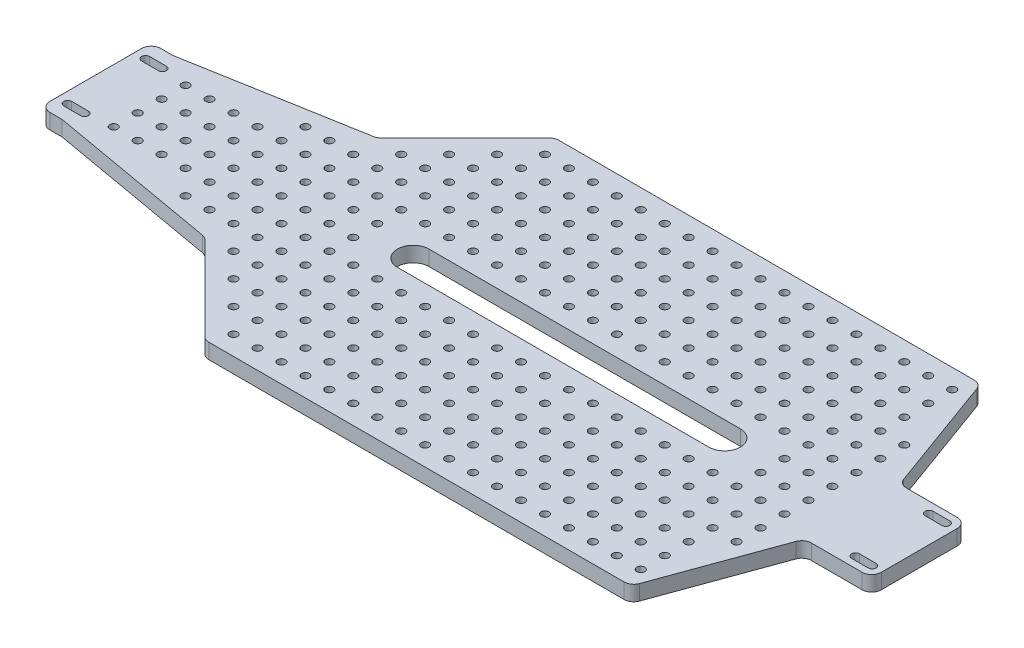
from build123d import *

# Parameters (mm, degrees)
BOSS_EXTRUDE1_DEPTH = 6.35
SKETCH2_R           = 1.65
CUT_EXTRUDE1_DEPTH  = 351.809047952
FILLET1_R           = 4


with BuildPart() as part:
    # Sketch1 → Boss-Extrude1 (new body)
    with BuildSketch(Plane(origin=(0, 0, 0), x_dir=(1, 0, 0), z_dir=(0, 1, 0))):
        Polygon((76.915952747, 52.145069954), (4.55, 39.385), (-4.55, 39.385), (-4.55, -6.885), (4.55, -6.885), (76.915952747, -19.645069954), (114.045882793, -56.775), (291.845882793, -56.775), (311.2, -3.6), (339.2, -3.6), (339.2, 36.1), (311.2, 36.1), (291.845882793, 89.275), (114.045882793, 89.275), align=None)
        with BuildLine():
            Line((7, -1.65), (0, -1.65))
            ThreePointArc((0, -1.65), (-1.65, 0), (0, 1.65))
            Line((0, 1.65), (7, 1.65))
            ThreePointArc((7, 1.65), (8.65, 0), (7, -1.65))
        make_face(mode=Mode.SUBTRACT)
        with BuildLine():
            Line((327.93, 2.525), (334.93, 2.525))
            ThreePointArc((334.93, 2.525), (336.58, 0.875), (334.93, -0.775))
            Line((334.93, -0.775), (327.93, -0.775))
            ThreePointArc((327.93, -0.775), (326.28, 0.875), (327.93, 2.525))
        make_face(mode=Mode.SUBTRACT)
        with BuildLine():
            ThreePointArc((0, 30.85), (-1.65, 32.5), (0, 34.15))
            Line((0, 34.15), (7, 34.15))
            ThreePointArc((7, 34.15), (8.65, 32.5), (7, 30.85))
            Line((7, 30.85), (0, 30.85))
        make_face(mode=Mode.SUBTRACT)
        with BuildLine():
            ThreePointArc((334.93, 33.275), (336.58, 31.625), (334.93, 29.975))
            Line((334.93, 29.975), (327.93, 29.975))
            ThreePointArc((327.93, 29.975), (326.28, 31.625), (327.93, 33.275))
            Line((327.93, 33.275), (334.93, 33.275))
        make_face(mode=Mode.SUBTRACT)
    extrude(amount=BOSS_EXTRUDE1_DEPTH)

    # Sketch2 → Cut-Extrude1 (cut, through all)
    with BuildSketch(Plane(origin=(0, 6.35, 0), x_dir=(1, 0, 0), z_dir=(0, 1, 0))):
        with Locations((117.945882793, 81.245)):
            Circle(SKETCH2_R)
        with Locations((127.945882793, 81.245)):
            Circle(SKETCH2_R)
        with Locations((137.945882793, 81.245)):
            Circle(SKETCH2_R)
        with Locations((147.945882793, 81.245)):
            Circle(SKETCH2_R)
        with Locations((157.945882793, 81.245)):
            Circle(SKETCH2_R)
        with Locations((167.945882793, 81.245)):
            Circle(SKETCH2_R)
        with Locations((177.945882793, 81.245)):
            Circle(SKETCH2_R)
        with Locations((187.945882793, 81.245)):
            Circle(SKETCH2_R)
        with Locations((197.945882793, 81.245)):
            Circle(SKETCH2_R)
        with Locations((207.945882793, 81.245)):
            Circle(SKETCH2_R)
        with Locations((217.945882793, 81.245)):
            Circle(SKETCH2_R)
        with Locations((227.945882793, 81.245)):
            Circle(SKETCH2_R)
        with Locations((237.945882793, 81.245)):
            Circle(SKETCH2_R)
        with Locations((247.945882793, 81.245)):
            Circle(SKETCH2_R)
        with Locations((257.945882793, 81.245)):
            Circle(SKETCH2_R)
        with Locations((267.945882793, 81.245)):
            Circle(SKETCH2_R)
        with Locations((277.945882793, 81.245)):
            Circle(SKETCH2_R)
        with Locations((287.945882793, 81.245)):
            Circle(SKETCH2_R)
        with Locations((127.945882793, 71.245)):
            Circle(SKETCH2_R)
        with Locations((137.945882793, 71.245)):
            Circle(SKETCH2_R)
        with Locations((147.945882793, 71.245)):
            Circle(SKETCH2_R)
        with Locations((157.945882793, 71.245)):
            Circle(SKETCH2_R)
        with Locations((167.945882793, 71.245)):
            Circle(SKETCH2_R)
        with Locations((177.945882793, 71.245)):
            Circle(SKETCH2_R)
        with Locations((187.945882793, 71.245)):
            Circle(SKETCH2_R)
        with Locations((197.945882793, 71.245)):
            Circle(SKETCH2_R)
        with Locations((207.945882793, 71.245)):
            Circle(SKETCH2_R)
        with Locations((217.945882793, 71.245)):
            Circle(SKETCH2_R)
        with Locations((227.945882793, 71.245)):
            Circle(SKETCH2_R)
        with Locations((237.945882793, 71.245)):
            Circle(SKETCH2_R)
        with Locations((247.945882793, 71.245)):
            Circle(SKETCH2_R)
        with Locations((257.945882793, 71.245)):
            Circle(SKETCH2_R)
        with Locations((267.945882793, 71.245)):
            Circle(SKETCH2_R)
        with Locations((277.945882793, 71.245)):
            Circle(SKETCH2_R)
        with Locations((287.945882793, 71.245)):
            Circle(SKETCH2_R)
        with Locations((127.945882793, 61.245)):
            Circle(SKETCH2_R)
        with Locations((137.945882793, 61.245)):
            Circle(SKETCH2_R)
        with Locations((147.945882793, 61.245)):
            Circle(SKETCH2_R)
        with Locations((157.945882793, 61.245)):
            Circle(SKETCH2_R)
        with Locations((167.945882793, 61.245)):
            Circle(SKETCH2_R)
        with Locations((177.945882793, 61.245)):
            Circle(SKETCH2_R)
        with Locations((187.945882793, 61.245)):
            Circle(SKETCH2_R)
        with Locations((197.945882793, 61.245)):
            Circle(SKETCH2_R)
        with Locations((207.945882793, 61.245)):
            Circle(SKETCH2_R)
        with Locations((217.945882793, 61.245)):
            Circle(SKETCH2_R)
        with Locations((227.945882793, 61.245)):
            Circle(SKETCH2_R)
        with Locations((237.945882793, 61.245)):
            Circle(SKETCH2_R)
        with Locations((247.945882793, 61.245)):
            Circle(SKETCH2_R)
        with Locations((257.945882793, 61.245)):
            Circle(SKETCH2_R)
        with Locations((267.945882793, 61.245)):
            Circle(SKETCH2_R)
        with Locations((277.945882793, 61.245)):
            Circle(SKETCH2_R)
        with Locations((287.945882793, 61.245)):
            Circle(SKETCH2_R)
        with Locations((127.945882793, 51.245)):
            Circle(SKETCH2_R)
        with Locations((137.945882793, 51.245)):
            Circle(SKETCH2_R)
        with Locations((147.945882793, 51.245)):
            Circle(SKETCH2_R)
        with Locations((157.945882793, 51.245)):
            Circle(SKETCH2_R)
        with Locations((167.945882793, 51.245)):
            Circle(SKETCH2_R)
        with Locations((177.945882793, 51.245)):
            Circle(SKETCH2_R)
        with Locations((187.945882793, 51.245)):
            Circle(SKETCH2_R)
        with Locations((197.945882793, 51.245)):
            Circle(SKETCH2_R)
        with Locations((207.945882793, 51.245)):
            Circle(SKETCH2_R)
        with Locations((217.945882793, 51.245)):
            Circle(SKETCH2_R)
        with Locations((227.945882793, 51.245)):
            Circle(SKETCH2_R)
        with Locations((237.945882793, 51.245)):
            Circle(SKETCH2_R)
        with Locations((247.945882793, 51.245)):
            Circle(SKETCH2_R)
        with Locations((257.945882793, 51.245)):
            Circle(SKETCH2_R)
        with Locations((267.945882793, 51.245)):
            Circle(SKETCH2_R)
        with Locations((277.945882793, 51.245)):
            Circle(SKETCH2_R)
        with Locations((287.945882793, 51.245)):
            Circle(SKETCH2_R)
        with Locations((127.945882793, 41.245)):
            Circle(SKETCH2_R)
        with Locations((137.945882793, 41.245)):
            Circle(SKETCH2_R)
        with Locations((147.945882793, 41.245)):
            Circle(SKETCH2_R)
        with Locations((157.945882793, 41.245)):
            Circle(SKETCH2_R)
        with Locations((167.945882793, 41.245)):
            Circle(SKETCH2_R)
        with Locations((177.945882793, 41.245)):
            Circle(SKETCH2_R)
        with Locations((187.945882793, 41.245)):
            Circle(SKETCH2_R)
        with Locations((197.945882793, 41.245)):
            Circle(SKETCH2_R)
        with Locations((207.945882793, 41.245)):
            Circle(SKETCH2_R)
        with Locations((217.945882793, 41.245)):
            Circle(SKETCH2_R)
        with Locations((227.945882793, 41.245)):
            Circle(SKETCH2_R)
        with Locations((237.945882793, 41.245)):
            Circle(SKETCH2_R)
        with Locations((247.945882793, 41.245)):
            Circle(SKETCH2_R)
        with Locations((257.945882793, 41.245)):
            Circle(SKETCH2_R)
        with Locations((267.945882793, 41.245)):
            Circle(SKETCH2_R)
        with Locations((277.945882793, 41.245)):
            Circle(SKETCH2_R)
        with Locations((287.945882793, 41.245)):
            Circle(SKETCH2_R)
        with Locations((127.945882793, 31.245)):
            Circle(SKETCH2_R)
        with Locations((137.945882793, 31.245)):
            Circle(SKETCH2_R)
        with Locations((147.945882793, 31.245)):
            Circle(SKETCH2_R)
        with Locations((157.945882793, 31.245)):
            Circle(SKETCH2_R)
        with Locations((167.945882793, 31.245)):
            Circle(SKETCH2_R)
        with Locations((177.945882793, 31.245)):
            Circle(SKETCH2_R)
        with Locations((187.945882793, 31.245)):
            Circle(SKETCH2_R)
        with Locations((197.945882793, 31.245)):
            Circle(SKETCH2_R)
        with Locations((207.945882793, 31.245)):
            Circle(SKETCH2_R)
        with Locations((217.945882793, 31.245)):
            Circle(SKETCH2_R)
        with Locations((227.945882793, 31.245)):
            Circle(SKETCH2_R)
        with Locations((237.945882793, 31.245)):
            Circle(SKETCH2_R)
        with Locations((247.945882793, 31.245)):
            Circle(SKETCH2_R)
        with Locations((257.945882793, 31.245)):
            Circle(SKETCH2_R)
        with Locations((267.945882793, 31.245)):
            Circle(SKETCH2_R)
        with Locations((277.945882793, 31.245)):
            Circle(SKETCH2_R)
        with Locations((287.945882793, 31.245)):
            Circle(SKETCH2_R)
        with Locations((277.945882793, 21.245)):
            Circle(SKETCH2_R)
        with Locations((287.945882793, 21.245)):
            Circle(SKETCH2_R)
        with Locations((277.945882793, 11.245)):
            Circle(SKETCH2_R)
        with Locations((287.945882793, 11.245)):
            Circle(SKETCH2_R)
        with Locations((127.945882793, 1.245)):
            Circle(SKETCH2_R)
        with Locations((137.945882793, 1.245)):
            Circle(SKETCH2_R)
        with Locations((147.945882793, 1.245)):
            Circle(SKETCH2_R)
        with Locations((157.945882793, 1.245)):
            Circle(SKETCH2_R)
        with Locations((167.945882793, 1.245)):
            Circle(SKETCH2_R)
        with Locations((177.945882793, 1.245)):
            Circle(SKETCH2_R)
        with Locations((187.945882793, 1.245)):
            Circle(SKETCH2_R)
        with Locations((197.945882793, 1.245)):
            Circle(SKETCH2_R)
        with Locations((207.945882793, 1.245)):
            Circle(SKETCH2_R)
        with Locations((217.945882793, 1.245)):
            Circle(SKETCH2_R)
        with Locations((227.945882793, 1.245)):
            Circle(SKETCH2_R)
        with Locations((237.945882793, 1.245)):
            Circle(SKETCH2_R)
        with Locations((247.945882793, 1.245)):
            Circle(SKETCH2_R)
        with Locations((257.945882793, 1.245)):
            Circle(SKETCH2_R)
        with Locations((267.945882793, 1.245)):
            Circle(SKETCH2_R)
        with Locations((277.945882793, 1.245)):
            Circle(SKETCH2_R)
        with Locations((287.945882793, 1.245)):
            Circle(SKETCH2_R)
        with Locations((127.945882793, -8.755)):
            Circle(SKETCH2_R)
        with Locations((137.945882793, -8.755)):
            Circle(SKETCH2_R)
        with Locations((147.945882793, -8.755)):
            Circle(SKETCH2_R)
        with Locations((157.945882793, -8.755)):
            Circle(SKETCH2_R)
        with Locations((167.945882793, -8.755)):
            Circle(SKETCH2_R)
        with Locations((177.945882793, -8.755)):
            Circle(SKETCH2_R)
        with Locations((187.945882793, -8.755)):
            Circle(SKETCH2_R)
        with Locations((197.945882793, -8.755)):
            Circle(SKETCH2_R)
        with Locations((207.945882793, -8.755)):
            Circle(SKETCH2_R)
        with Locations((217.945882793, -8.755)):
            Circle(SKETCH2_R)
        with Locations((227.945882793, -8.755)):
            Circle(SKETCH2_R)
        with Locations((237.945882793, -8.755)):
            Circle(SKETCH2_R)
        with Locations((247.945882793, -8.755)):
            Circle(SKETCH2_R)
        with Locations((257.945882793, -8.755)):
            Circle(SKETCH2_R)
        with Locations((267.945882793, -8.755)):
            Circle(SKETCH2_R)
        with Locations((277.945882793, -8.755)):
            Circle(SKETCH2_R)
        with Locations((287.945882793, -8.755)):
            Circle(SKETCH2_R)
        with Locations((127.945882793, -18.755)):
            Circle(SKETCH2_R)
        with Locations((137.945882793, -18.755)):
            Circle(SKETCH2_R)
        with Locations((147.945882793, -18.755)):
            Circle(SKETCH2_R)
        with Locations((157.945882793, -18.755)):
            Circle(SKETCH2_R)
        with Locations((167.945882793, -18.755)):
            Circle(SKETCH2_R)
        with Locations((177.945882793, -18.755)):
            Circle(SKETCH2_R)
        with Locations((187.945882793, -18.755)):
            Circle(SKETCH2_R)
        with Locations((197.945882793, -18.755)):
            Circle(SKETCH2_R)
        with Locations((207.945882793, -18.755)):
            Circle(SKETCH2_R)
        with Locations((217.945882793, -18.755)):
            Circle(SKETCH2_R)
        with Locations((227.945882793, -18.755)):
            Circle(SKETCH2_R)
        with Locations((237.945882793, -18.755)):
            Circle(SKETCH2_R)
        with Locations((247.945882793, -18.755)):
            Circle(SKETCH2_R)
        with Locations((257.945882793, -18.755)):
            Circle(SKETCH2_R)
        with Locations((267.945882793, -18.755)):
            Circle(SKETCH2_R)
        with Locations((277.945882793, -18.755)):
            Circle(SKETCH2_R)
        with Locations((287.945882793, -18.755)):
            Circle(SKETCH2_R)
        with Locations((127.945882793, -28.755)):
            Circle(SKETCH2_R)
        with Locations((137.945882793, -28.755)):
            Circle(SKETCH2_R)
        with Locations((147.945882793, -28.755)):
            Circle(SKETCH2_R)
        with Locations((157.945882793, -28.755)):
            Circle(SKETCH2_R)
        with Locations((167.945882793, -28.755)):
            Circle(SKETCH2_R)
        with Locations((177.945882793, -28.755)):
            Circle(SKETCH2_R)
        with Locations((187.945882793, -28.755)):
            Circle(SKETCH2_R)
        with Locations((197.945882793, -28.755)):
            Circle(SKETCH2_R)
        with Locations((207.945882793, -28.755)):
            Circle(SKETCH2_R)
        with Locations((217.945882793, -28.755)):
            Circle(SKETCH2_R)
        with Locations((227.945882793, -28.755)):
            Circle(SKETCH2_R)
        with Locations((237.945882793, -28.755)):
            Circle(SKETCH2_R)
        with Locations((247.945882793, -28.755)):
            Circle(SKETCH2_R)
        with Locations((257.945882793, -28.755)):
            Circle(SKETCH2_R)
        with Locations((267.945882793, -28.755)):
            Circle(SKETCH2_R)
        with Locations((277.945882793, -28.755)):
            Circle(SKETCH2_R)
        with Locations((287.945882793, -28.755)):
            Circle(SKETCH2_R)
        with Locations((127.945882793, -38.755)):
            Circle(SKETCH2_R)
        with Locations((137.945882793, -38.755)):
            Circle(SKETCH2_R)
        with Locations((147.945882793, -38.755)):
            Circle(SKETCH2_R)
        with Locations((157.945882793, -38.755)):
            Circle(SKETCH2_R)
        with Locations((167.945882793, -38.755)):
            Circle(SKETCH2_R)
        with Locations((177.945882793, -38.755)):
            Circle(SKETCH2_R)
        with Locations((187.945882793, -38.755)):
            Circle(SKETCH2_R)
        with Locations((197.945882793, -38.755)):
            Circle(SKETCH2_R)
        with Locations((207.945882793, -38.755)):
            Circle(SKETCH2_R)
        with Locations((217.945882793, -38.755)):
            Circle(SKETCH2_R)
        with Locations((227.945882793, -38.755)):
            Circle(SKETCH2_R)
        with Locations((237.945882793, -38.755)):
            Circle(SKETCH2_R)
        with Locations((247.945882793, -38.755)):
            Circle(SKETCH2_R)
        with Locations((257.945882793, -38.755)):
            Circle(SKETCH2_R)
        with Locations((267.945882793, -38.755)):
            Circle(SKETCH2_R)
        with Locations((277.945882793, -38.755)):
            Circle(SKETCH2_R)
        with Locations((287.945882793, -38.755)):
            Circle(SKETCH2_R)
        with Locations((127.945882793, -48.755)):
            Circle(SKETCH2_R)
        with Locations((137.945882793, -48.755)):
            Circle(SKETCH2_R)
        with Locations((147.945882793, -48.755)):
            Circle(SKETCH2_R)
        with Locations((157.945882793, -48.755)):
            Circle(SKETCH2_R)
        with Locations((167.945882793, -48.755)):
            Circle(SKETCH2_R)
        with Locations((177.945882793, -48.755)):
            Circle(SKETCH2_R)
        with Locations((187.945882793, -48.755)):
            Circle(SKETCH2_R)
        with Locations((197.945882793, -48.755)):
            Circle(SKETCH2_R)
        with Locations((207.945882793, -48.755)):
            Circle(SKETCH2_R)
        with Locations((217.945882793, -48.755)):
            Circle(SKETCH2_R)
        with Locations((227.945882793, -48.755)):
            Circle(SKETCH2_R)
        with Locations((237.945882793, -48.755)):
            Circle(SKETCH2_R)
        with Locations((247.945882793, -48.755)):
            Circle(SKETCH2_R)
        with Locations((257.945882793, -48.755)):
            Circle(SKETCH2_R)
        with Locations((267.945882793, -48.755)):
            Circle(SKETCH2_R)
        with Locations((277.945882793, -48.755)):
            Circle(SKETCH2_R)
        with Locations((287.945882793, -48.755)):
            Circle(SKETCH2_R)
        with Locations((117.945882793, 71.245)):
            Circle(SKETCH2_R)
        with Locations((117.945882793, 61.245)):
            Circle(SKETCH2_R)
        with Locations((117.945882793, 51.245)):
            Circle(SKETCH2_R)
        with Locations((117.945882793, 41.245)):
            Circle(SKETCH2_R)
        with Locations((117.945882793, 31.245)):
            Circle(SKETCH2_R)
        with Locations((117.945882793, 1.245)):
            Circle(SKETCH2_R)
        with Locations((117.945882793, -8.755)):
            Circle(SKETCH2_R)
        with Locations((117.945882793, -18.755)):
            Circle(SKETCH2_R)
        with Locations((117.945882793, -28.755)):
            Circle(SKETCH2_R)
        with Locations((117.945882793, -38.755)):
            Circle(SKETCH2_R)
        with Locations((117.945882793, -48.755)):
            Circle(SKETCH2_R)
        with Locations((297.945882793, 51.245)):
            Circle(SKETCH2_R)
        with Locations((297.945882793, 41.245)):
            Circle(SKETCH2_R)
        with Locations((297.945882793, 31.245)):
            Circle(SKETCH2_R)
        with Locations((297.945882793, 21.245)):
            Circle(SKETCH2_R)
        with Locations((297.945882793, 11.245)):
            Circle(SKETCH2_R)
        with Locations((297.945882793, 1.245)):
            Circle(SKETCH2_R)
        with Locations((297.945882793, -8.755)):
            Circle(SKETCH2_R)
        with Locations((297.945882793, -18.755)):
            Circle(SKETCH2_R)
        with Locations((107.945882793, 71.245)):
            Circle(SKETCH2_R)
        with Locations((97.945882793, 61.245)):
            Circle(SKETCH2_R)
        with Locations((97.945882793, 51.245)):
            Circle(SKETCH2_R)
        with Locations((87.945882793, 51.245)):
            Circle(SKETCH2_R)
        with Locations((97.945882793, 41.245)):
            Circle(SKETCH2_R)
        with Locations((87.945882793, 41.245)):
            Circle(SKETCH2_R)
        with Locations((97.945882793, 31.245)):
            Circle(SKETCH2_R)
        with Locations((87.945882793, 31.245)):
            Circle(SKETCH2_R)
        with Locations((97.945882793, 21.245)):
            Circle(SKETCH2_R)
        with Locations((87.945882793, 21.245)):
            Circle(SKETCH2_R)
        with Locations((97.945882793, 11.245)):
            Circle(SKETCH2_R)
        with Locations((87.945882793, 11.245)):
            Circle(SKETCH2_R)
        with Locations((97.945882793, 1.245)):
            Circle(SKETCH2_R)
        with Locations((87.945882793, 1.245)):
            Circle(SKETCH2_R)
        with Locations((97.945882793, -8.755)):
            Circle(SKETCH2_R)
        with Locations((87.945882793, -8.755)):
            Circle(SKETCH2_R)
        with Locations((97.945882793, -18.755)):
            Circle(SKETCH2_R)
        with Locations((87.945882793, -18.755)):
            Circle(SKETCH2_R)
        with Locations((97.945882793, -28.755)):
            Circle(SKETCH2_R)
        with Locations((107.945882793, 61.245)):
            Circle(SKETCH2_R)
        with Locations((107.945882793, 51.245)):
            Circle(SKETCH2_R)
        with Locations((107.945882793, 41.245)):
            Circle(SKETCH2_R)
        with Locations((107.945882793, 31.245)):
            Circle(SKETCH2_R)
        with Locations((107.945882793, 21.245)):
            Circle(SKETCH2_R)
        with Locations((107.945882793, 11.245)):
            Circle(SKETCH2_R)
        with Locations((107.945882793, 1.245)):
            Circle(SKETCH2_R)
        with Locations((107.945882793, -8.755)):
            Circle(SKETCH2_R)
        with Locations((107.945882793, -18.755)):
            Circle(SKETCH2_R)
        with Locations((107.945882793, -28.755)):
            Circle(SKETCH2_R)
        with Locations((107.945882793, -38.755)):
            Circle(SKETCH2_R)
        with Locations((77.945882793, 41.245)):
            Circle(SKETCH2_R)
        with Locations((67.945882793, 41.245)):
            Circle(SKETCH2_R)
        with Locations((57.945882793, 41.245)):
            Circle(SKETCH2_R)
        with Locations((67.945882793, 31.245)):
            Circle(SKETCH2_R)
        with Locations((57.945882793, 31.245)):
            Circle(SKETCH2_R)
        with Locations((47.945882793, 31.245)):
            Circle(SKETCH2_R)
        with Locations((37.945882793, 31.245)):
            Circle(SKETCH2_R)
        with Locations((27.945882793, 31.245)):
            Circle(SKETCH2_R)
        with Locations((17.945882793, 31.245)):
            Circle(SKETCH2_R)
        with Locations((67.945882793, 21.245)):
            Circle(SKETCH2_R)
        with Locations((57.945882793, 21.245)):
            Circle(SKETCH2_R)
        with Locations((47.945882793, 21.245)):
            Circle(SKETCH2_R)
        with Locations((37.945882793, 21.245)):
            Circle(SKETCH2_R)
        with Locations((27.945882793, 21.245)):
            Circle(SKETCH2_R)
        with Locations((17.945882793, 21.245)):
            Circle(SKETCH2_R)
        with Locations((67.945882793, 11.245)):
            Circle(SKETCH2_R)
        with Locations((57.945882793, 11.245)):
            Circle(SKETCH2_R)
        with Locations((47.945882793, 11.245)):
            Circle(SKETCH2_R)
        with Locations((37.945882793, 11.245)):
            Circle(SKETCH2_R)
        with Locations((27.945882793, 11.245)):
            Circle(SKETCH2_R)
        with Locations((17.945882793, 11.245)):
            Circle(SKETCH2_R)
        with Locations((67.945882793, 1.245)):
            Circle(SKETCH2_R)
        with Locations((57.945882793, 1.245)):
            Circle(SKETCH2_R)
        with Locations((47.945882793, 1.245)):
            Circle(SKETCH2_R)
        with Locations((37.945882793, 1.245)):
            Circle(SKETCH2_R)
        with Locations((27.945882793, 1.245)):
            Circle(SKETCH2_R)
        with Locations((17.945882793, 1.245)):
            Circle(SKETCH2_R)
        with Locations((67.945882793, -8.755)):
            Circle(SKETCH2_R)
        with Locations((57.945882793, -8.755)):
            Circle(SKETCH2_R)
        with Locations((77.945882793, 31.245)):
            Circle(SKETCH2_R)
        with Locations((77.945882793, 21.245)):
            Circle(SKETCH2_R)
        with Locations((77.945882793, 11.245)):
            Circle(SKETCH2_R)
        with Locations((77.945882793, 1.245)):
            Circle(SKETCH2_R)
        with Locations((77.945882793, -8.755)):
            Circle(SKETCH2_R)
        with BuildLine():
            Line((127.945882793, 22.845), (257.945882793, 22.845))
            ThreePointArc((257.945882793, 22.845), (264.545882793, 16.245), (257.945882793, 9.645))
            Line((257.945882793, 9.645), (127.945882793, 9.645))
            ThreePointArc((127.945882793, 9.645), (121.345882793, 16.245), (127.945882793, 22.845))
        make_face()
    extrude(amount=-CUT_EXTRUDE1_DEPTH, mode=Mode.SUBTRACT)

    # Fillet1
    fillet1_edges = [part.edges().sort_by_distance(p)[0] for p in [
        (76.915952747, 3.175, -52.145069954),
        (114.045882793, 3.175, -89.275),
        (291.845882793, 3.175, -89.275),
        (311.2, 3.175, -36.1),
        (339.2, 3.175, -36.1),
        (339.2, 3.175, 3.6),
        (311.2, 3.175, 3.6),
        (291.845882793, 3.175, 56.775),
        (-4.55, 3.175, -39.385),
        (-4.55, 3.175, 6.885),
        (76.915952747, 3.175, 19.645069954),
        (114.045882793, 3.175, 56.775),
    ]]
    fillet(fillet1_edges, radius=FILLET1_R)


solid = part.part
